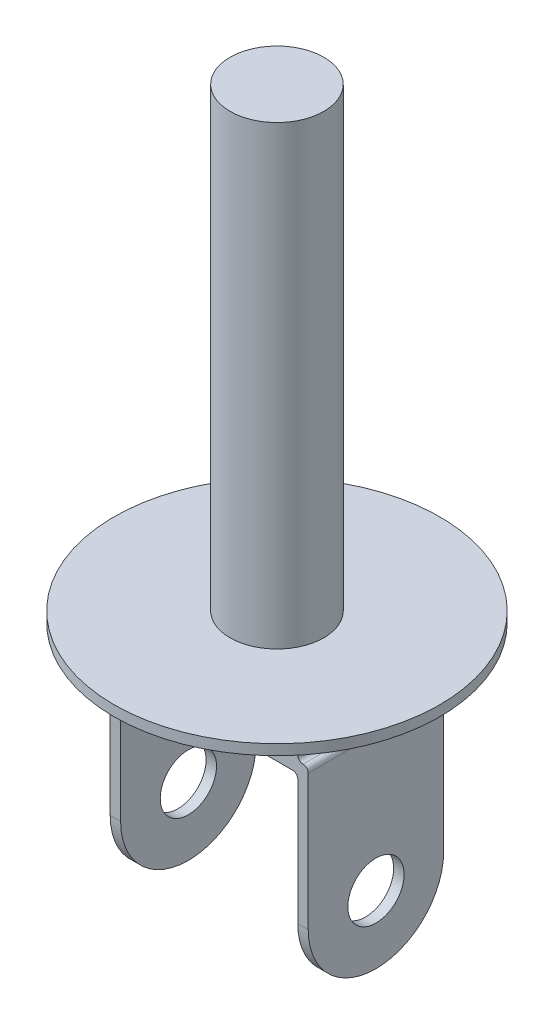
from build123d import *

# Parameters (mm, degrees)
SKETCH1_R               = 31.25
BOSS_EXTRUDE1_DEPTH     = 2
SKETCH2_W               = 38
SKETCH2_H               = 26
BOSS_EXTRUDE2_DEPTH     = 48
SKETCH3_W               = 34
SKETCH3_H               = 38
CUT_EXTRUDE1_DEPTH      = 48
CUT_EXTRUDE2_DEPTH      = 48
M12X1_25_TAPPED_HOLE1_D = 10.8
SKETCH7_W               = 2
SKETCH7_H               = 6
CUT_EXTRUDE3_DEPTH      = 48
FILLET2_R               = 1
SKETCH8_R               = 9
BOSS_EXTRUDE3_DEPTH     = 87.5


with BuildPart() as part:
    # Sketch1 → Boss-Extrude1 (new body)
    with BuildSketch(Plane(origin=(0, 0, 0), x_dir=(1, 0, 0), z_dir=(0, 1, 0))):
        with Locations(Location((0, 0, 0), (0, 0, 270))):
            Circle(SKETCH1_R)
    extrude(amount=BOSS_EXTRUDE1_DEPTH)

    # Sketch2 → Boss-Extrude2 (add)
    with BuildSketch(Plane.XZ):
        Rectangle(SKETCH2_W, SKETCH2_H)
    extrude(amount=BOSS_EXTRUDE2_DEPTH)

    # Sketch3 → Cut-Extrude1 (cut)
    with BuildSketch(Plane.XY.offset(13)):
        with Locations((0, -29)):
            Rectangle(SKETCH3_W, SKETCH3_H)
    extrude(amount=-CUT_EXTRUDE1_DEPTH, mode=Mode.SUBTRACT)

    # Sketch4 → Cut-Extrude2 (cut)
    with BuildSketch(Plane(origin=(19, 0, 0), x_dir=(0, 0, -1), z_dir=(1, 0, 0))):
        with BuildLine():
            ThreePointArc((0, -48), (-9.192388155, -44.192388155), (-13, -35))
            Line((-13, -35), (-13, -48))
            Line((-13, -48), (0, -48))
        make_face()
        with BuildLine():
            Line((13, -48), (13, -35))
            ThreePointArc((13, -35), (9.192388155, -44.192388155), (0, -48))
            Line((0, -48), (13, -48))
        make_face()
    extrude(amount=-CUT_EXTRUDE2_DEPTH, mode=Mode.SUBTRACT)

    # M12x1.25 Tapped Hole1 (through all)
    with Locations(Plane(origin=(19, 0, 0), x_dir=(0, 0, -1), z_dir=(1, 0, 0))):
        with Locations((0, -35)):
            Hole(M12X1_25_TAPPED_HOLE1_D / 2)

    # Sketch7 → Cut-Extrude3 (cut)
    with BuildSketch(Plane(origin=(0, 0, -13), x_dir=(-1, 0, 0), z_dir=(0, 0, -1))):
        with Locations((-18, -5)):
            Rectangle(SKETCH7_W, SKETCH7_H)
        with Locations((18, -5)):
            Rectangle(SKETCH7_W, SKETCH7_H)
    extrude(amount=-CUT_EXTRUDE3_DEPTH, mode=Mode.SUBTRACT)

    # Fillet2
    fillet2_edges = [part.edges().sort_by_distance(p)[0] for p in [
        (17, -10, 0),
        (-17, -10, 0),
        (19, -8, 0),
        (17, -8, 0),
        (17, -2, 0),
        (19, -2, 0),
        (19, 0, 0),
        (-19, 0, 0),
        (-19, -2, 0),
        (-17, -2, 0),
        (-17, -8, 0),
        (-19, -8, 0),
    ]]
    fillet(fillet2_edges, radius=FILLET2_R - 0.0001)  # a hair under: the kernel refuses the full size

    # Sketch8 → Boss-Extrude3 (add)
    with BuildSketch(Plane(origin=(0, 2, 0), x_dir=(1, 0, 0), z_dir=(0, 1, 0))):
        with Locations(Location((0, 0, 0), (0, 0, 270))):
            Circle(SKETCH8_R)
    extrude(amount=BOSS_EXTRUDE3_DEPTH)


solid = part.part
